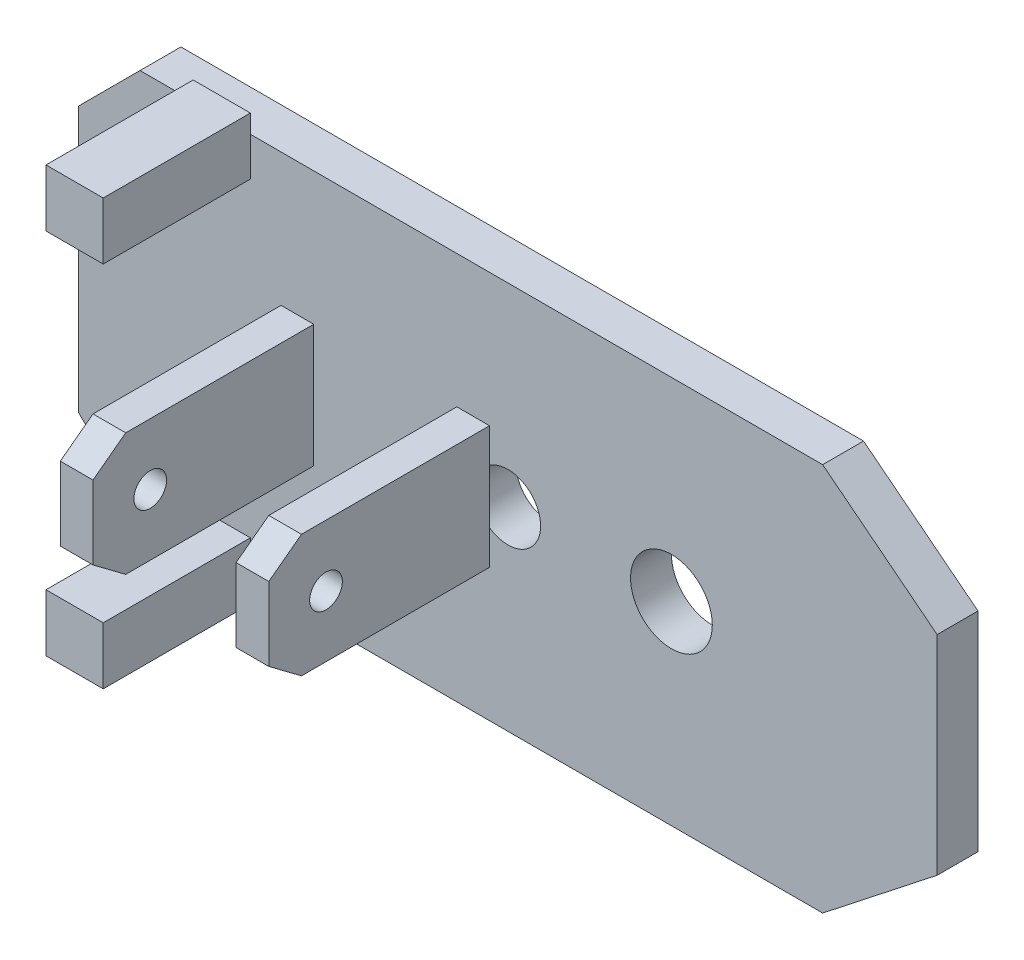
from build123d import *

# Parameters (mm, degrees)
SK_SOLE_PLATE_R    = 10
SK_SOLE_PLATE_R_2  = 8
SOLE_PLATE_DEPTH   = 10
SK_CLEVIS_FRONT_R  = 4
CLEVIS_FRONT_DEPTH = 8
SK_CLEVIS_BACK_R   = 4
CLEVIS_BACK_DEPTH  = 8
SK_POST_LAT_W      = 14
SK_POST_LAT_H      = 14
POST_LAT_DEPTH     = 36
SK_POST_MED_W      = 14
SK_POST_MED_H      = 14
POST_MED_DEPTH     = 36


with BuildPart() as part:
    # SK_Sole_Plate → Sole_Plate (new body)
    with BuildSketch(Plane.XY.offset(-50)):
        Polygon((-60, -47.5), (107, -47.5), (135, -25.5), (135, 25.5), (107, 47.5), (-60, 47.5), (-75, 32.5), (-75, -32.5), align=None)
        with Locations((70, 0)):
            Circle(SK_SOLE_PLATE_R, mode=Mode.SUBTRACT)
        with Locations((30, 0)):
            Circle(SK_SOLE_PLATE_R_2, mode=Mode.SUBTRACT)
    extrude(amount=SOLE_PLATE_DEPTH)

    # SK_Clevis_Front → Clevis_Front (add)
    with BuildSketch(Plane(origin=(17.5, 0, 0), x_dir=(0, 0, -1), z_dir=(1, 0, 0))):
        Polygon((40, -15), (40, 15), (-6, 15), (-14, 9), (-14, -9), (-6, -15), align=None)
        Circle(SK_CLEVIS_FRONT_R, mode=Mode.SUBTRACT)
    extrude(amount=CLEVIS_FRONT_DEPTH)

    # SK_Clevis_Back → Clevis_Back (add)
    with BuildSketch(Plane(origin=(-25.5, 0, 0), x_dir=(0, 0, -1), z_dir=(1, 0, 0))):
        Polygon((40, -15), (40, 15), (-6, 15), (-14, 9), (-14, -9), (-6, -15), align=None)
        Circle(SK_CLEVIS_BACK_R, mode=Mode.SUBTRACT)
    extrude(amount=CLEVIS_BACK_DEPTH)

    # SK_Post_Lat → Post_Lat (add)
    with BuildSketch(Plane.XY.offset(-40)):
        with Locations((-40, 45)):
            Rectangle(SK_POST_LAT_W, SK_POST_LAT_H)
    extrude(amount=POST_LAT_DEPTH)

    # SK_Post_Med → Post_Med (add)
    with BuildSketch(Plane.XY.offset(-40)):
        with Locations((-40, -45)):
            Rectangle(SK_POST_MED_W, SK_POST_MED_H)
    extrude(amount=POST_MED_DEPTH)


solid = part.part
